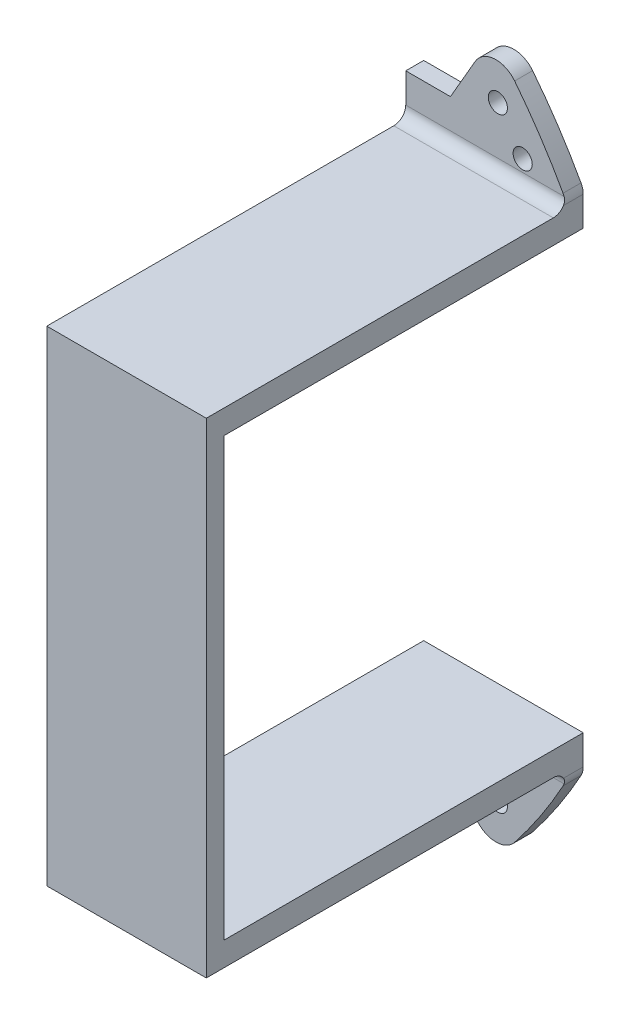
from build123d import *

# Parameters (mm, degrees)
BOSS_EXTRUDE1_OUTLINE_R = 1.6
BOSS_EXTRUDE1_DEPTH     = 3
SKETCH4_W               = 26.662281873
SKETCH4_H               = 4
BOSS_EXTRUDE2_DEPTH     = 57
SKETCH5_W               = 26.662281873
SKETCH5_H               = 81.026436392
BOSS_EXTRUDE3_DEPTH     = 3
FILLET3_R               = 2


# Read off the part's stored shape, not the designer's step: Boss-Extrude1
with BuildPart() as part:
    # Boss-Extrude1 outline → Boss-Extrude1 (new body)
    # profile 1 of 2: a face of its own
    with BuildSketch(Plane.XY):
        with BuildLine():
            ThreePointArc((63.289582375, -54.620772264), (66.466019523, -56.610414999), (69.895033825, -55.0970439))
            ThreePointArc((69.895033825, -55.0970439), (74.189882191, -49.161584399), (77.981994569, -42.892989206))
            ThreePointArc((77.981994569, -42.892989206), (78.25905658, -42.193542837), (78.353388011, -41.447158109))
            Line((78.353388011, -41.447158109), (78.353388011, -36.513218196))
            Line((78.353388011, -36.513218196), (51.691106138, -36.513218196))
            Line((51.691106138, -36.513218196), (51.691106138, -47.469854476))
            Line((51.691106138, -47.469854476), (59.160998066, -47.469854476))
            Line((59.160998066, -47.469854476), (63.289582375, -54.620772264))
        make_face()
        with Locations((67.085382844, -50.552461945)):
            Circle(BOSS_EXTRUDE1_OUTLINE_R, mode=Mode.SUBTRACT)
        with Locations((71.236040077, -44.513218196)):
            Circle(BOSS_EXTRUDE1_OUTLINE_R, mode=Mode.SUBTRACT)
    # profile 2 of 2: a face of its own
    with BuildSketch(Plane.XY):
        with BuildLine():
            Line((78.353388011, 36.513218196), (78.353388011, 41.447158109))
            ThreePointArc((78.353388011, 41.447158109), (78.25905658, 42.193542837), (77.981994569, 42.892989206))
            ThreePointArc((77.981994569, 42.892989206), (74.189882191, 49.161584398), (69.895033826, 55.0970439))
            ThreePointArc((69.895033826, 55.0970439), (66.466019523, 56.610414999), (63.289582375, 54.620772264))
            Line((63.289582375, 54.620772264), (59.160998066, 47.469854476))
            Line((59.160998066, 47.469854476), (51.691106138, 47.469854476))
            Line((51.691106138, 47.469854476), (51.691106138, 36.513218196))
            Line((51.691106138, 36.513218196), (78.353388011, 36.513218196))
        make_face()
        with Locations((67.085382844, 50.552461945)):
            Circle(BOSS_EXTRUDE1_OUTLINE_R, mode=Mode.SUBTRACT)
        with Locations((71.236040077, 44.513218196)):
            Circle(BOSS_EXTRUDE1_OUTLINE_R, mode=Mode.SUBTRACT)
    extrude(amount=BOSS_EXTRUDE1_DEPTH)

    # Sketch4 → Boss-Extrude2 (add)
    with BuildSketch(Plane.XY.offset(3)):
        with Locations((65.022247075, 38.513218196)):
            Rectangle(SKETCH4_W, SKETCH4_H)
        with Locations((65.022247075, -38.513218196)):
            Rectangle(SKETCH4_W, SKETCH4_H)
    extrude(amount=BOSS_EXTRUDE2_DEPTH)

    # Sketch5 → Boss-Extrude3 (add)
    with BuildSketch(Plane.XY.offset(60)):
        with Locations((65.022247075, 0)):
            Rectangle(SKETCH5_W, SKETCH5_H)
    extrude(amount=BOSS_EXTRUDE3_DEPTH)

    # Fillet3
    fillet3_edges = [part.edges().sort_by_distance(p)[0] for p in [
        (65.022247075, -40.513218196, 3),
        (65.022247075, 40.513218196, 3),
    ]]
    fillet(fillet3_edges, radius=FILLET3_R)


solid = part.part
